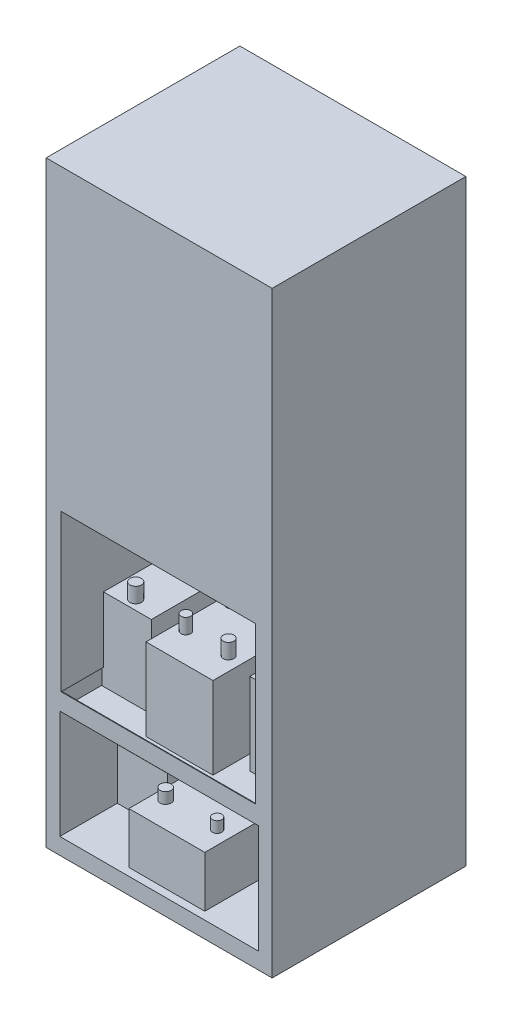
from build123d import *

# Parameters (mm, degrees)
CROQUIS1_W              = 700
CROQUIS1_H              = 600
SALIENTE_EXTRUIR1_DEPTH = 1850
CROQUIS2_W              = 615.213502424
CROQUIS2_H              = 336.389596981
CORTAR_EXTRUIR1_DEPTH   = 1850
CROQUIS3_W              = 601.471689429
CROQUIS3_H              = 484.058253594
CORTAR_EXTRUIR2_DEPTH   = 1850
VACIADO1_START          = 927
VACIADO1_OUTLINE_W      = 696
VACIADO1_OUTLINE_H      = 596
VACIADO1_DEPTH          = 921
VACIADO1_START_2        = 2
VACIADO1_2_OUTLINE_W    = 38.393248788
VACIADO1_2_OUTLINE_H    = 596
VACIADO1_2_DEPTH        = 925
VACIADO1_START_3        = 389.289586049
VACIADO1_3_OUTLINE_W    = 619.213502424
VACIADO1_3_OUTLINE_H    = 596
VACIADO1_3_DEPTH        = 51.652160357
VACIADO1_4_OUTLINE_W    = 619.213502424
VACIADO1_4_OUTLINE_H    = 596
VACIADO1_4_DEPTH        = 46.899989068
VACIADO1_START_4        = 440.941746406
VACIADO1_5_OUTLINE_W    = 9.875527386
VACIADO1_5_OUTLINE_H    = 596
VACIADO1_5_OUTLINE_W_2  = 3.866285609
VACIADO1_5_DEPTH        = 486.058253594
CROQUIS4_W              = 155.811040743
CROQUIS4_H              = 337.39949018
CROQUIS4_W_2            = 207.292949962
CROQUIS4_H_2            = 473.99302583
CROQUIS4_W_3            = 153.187153329
CROQUIS4_H_3            = 334.913299481
SALIENTE_EXTRUIR2_DEPTH = 254
CROQUIS5_R              = 17.695739631
CROQUIS5_R_2            = 14.878547438
CROQUIS5_R_3            = 20.046068399
CROQUIS5_R_4            = 15.612705271
CROQUIS5_R_5            = 20.069748599
CROQUIS5_R_6            = 21.515316786
CROQUIS5_R_7            = 19.11675051
CROQUIS5_R_8            = 16.429789051
SALIENTE_EXTRUIR3_DEPTH = 47
CROQUIS6_W              = 235.100540812
CROQUIS6_H              = 552.359872766
CROQUIS6_W_2            = 155.124272019
CROQUIS6_H_2            = 243.948410626
CROQUIS6_W_3            = 136.509991439
SALIENTE_EXTRUIR4_DEPTH = 158
CROQUIS7_R              = 21.309931324
CROQUIS7_R_2            = 19.709234989
CROQUIS7_R_3            = 17.138465207
CROQUIS7_R_4            = 14.538713976
CROQUIS7_R_5            = 19.196161078
CROQUIS7_R_6            = 15.424618687
CROQUIS7_R_7            = 17.995388468
CROQUIS7_R_8            = 20.519963126
CROQUIS7_R_9            = 17.445012433
CROQUIS7_R_10           = 21.115852911
SALIENTE_EXTRUIR5_DEPTH = 34
SALIENTE_EXTRUIR6_DEPTH = 34
CORTAR_EXTRUIR3_DEPTH   = 0.2
CORTAR_EXTRUIR4_DEPTH   = 0.2
CROQUIS11_R             = 8.638199992
CROQUIS11_R_2           = 9.502019992
CORTAR_EXTRUIR5_DEPTH   = 0.2
MATRIZL1_COUNT          = 36
MATRIZL1_PITCH          = 50
CROQUIS12_R             = 7.900023995
CORTAR_EXTRUIR6_DEPTH   = 0.2
MATRIZL2_COUNT          = 30
MATRIZL2_PITCH          = 20


# Read off the part's stored shape, not the designer's step: Vaciado1
with BuildPart() as part:
    # Croquis1 → Saliente-Extruir1 (new body)
    with BuildSketch(Plane(origin=(0, 0, 0), x_dir=(1, 0, 0), z_dir=(0, 1, 0))):
        Rectangle(CROQUIS1_W, CROQUIS1_H)
    extrude(amount=SALIENTE_EXTRUIR1_DEPTH)

    # Croquis2 → Cortar-Extruir1 (cut)
    with BuildSketch(Plane.XY.offset(300)):
        with Locations((0, 219.094787559)):
            Rectangle(CROQUIS2_W, CROQUIS2_H)
    extrude(amount=-CORTAR_EXTRUIR1_DEPTH, mode=Mode.SUBTRACT)

    # Croquis3 → Cortar-Extruir2 (cut)
    with BuildSketch(Plane.XY.offset(300)):
        with Locations((-3.004620888, 682.970873203)):
            Rectangle(CROQUIS3_W, CROQUIS3_H)
    extrude(amount=-CORTAR_EXTRUIR2_DEPTH, mode=Mode.SUBTRACT)

    # Vaciado1 outline → Vaciado1 (cut)
    with BuildSketch(Plane(origin=(0, 0, 0), x_dir=(1, 0, 0), z_dir=(0, 1, 0)).offset(VACIADO1_START)):
        Rectangle(VACIADO1_OUTLINE_W, VACIADO1_OUTLINE_H)
    extrude(amount=VACIADO1_DEPTH, mode=Mode.SUBTRACT)

    # Vaciado1 2 outline → Vaciado1 2 (cut)
    with BuildSketch(Plane(origin=(0, 0, 0), x_dir=(1, 0, 0), z_dir=(0, 1, 0)).offset(VACIADO1_START_2)):
        with Locations((328.803375606, 0)):
            Rectangle(VACIADO1_2_OUTLINE_W, VACIADO1_2_OUTLINE_H)
        with Locations((-328.803375606, 0)):
            Rectangle(VACIADO1_2_OUTLINE_W, VACIADO1_2_OUTLINE_H)
    extrude(amount=VACIADO1_2_DEPTH, mode=Mode.SUBTRACT)

    # Vaciado1 3 outline → Vaciado1 3 (cut)
    with BuildSketch(Plane(origin=(0, 0, 0), x_dir=(1, 0, 0), z_dir=(0, 1, 0)).offset(VACIADO1_START_3)):
        Rectangle(VACIADO1_3_OUTLINE_W, VACIADO1_3_OUTLINE_H)
    extrude(amount=VACIADO1_3_DEPTH, mode=Mode.SUBTRACT)

    # Vaciado1 4 outline → Vaciado1 4 (cut)
    with BuildSketch(Plane(origin=(0, 0, 0), x_dir=(1, 0, 0), z_dir=(0, 1, 0)).offset(VACIADO1_START_2)):
        Rectangle(VACIADO1_4_OUTLINE_W, VACIADO1_4_OUTLINE_H)
    extrude(amount=VACIADO1_4_DEPTH, mode=Mode.SUBTRACT)

    # Vaciado1 5 outline → Vaciado1 5 (cut)
    with BuildSketch(Plane(origin=(0, 0, 0), x_dir=(1, 0, 0), z_dir=(0, 1, 0)).offset(VACIADO1_START_4)):
        with Locations((304.668987519, 0)):
            Rectangle(VACIADO1_5_OUTLINE_W, VACIADO1_5_OUTLINE_H)
        with Locations((-307.673608408, 0)):
            Rectangle(VACIADO1_5_OUTLINE_W_2, VACIADO1_5_OUTLINE_H)
    extrude(amount=VACIADO1_5_DEPTH, mode=Mode.SUBTRACT)

    # Croquis4 → Saliente-Extruir2 (add)
    with BuildSketch(Plane(origin=(0, 389.289586049, 0), x_dir=(1, 0, 0), z_dir=(0, 1, 0))):
        with Locations((227.516652399, 0)):
            Rectangle(CROQUIS4_W, CROQUIS4_H)
        Rectangle(CROQUIS4_W_2, CROQUIS4_H_2)
        with Locations((-232.063289137, -1.24309535)):
            Rectangle(CROQUIS4_W_3, CROQUIS4_H_3)
    extrude(amount=SALIENTE_EXTRUIR2_DEPTH)

    # Croquis5 → Saliente-Extruir3 (add)
    with BuildSketch(Plane(origin=(0, 643.289586049, 0), x_dir=(1, 0, 0), z_dir=(0, 1, 0))):
        with Locations(Location((230.044615203, -120.710223911, 0), (0, 0, 270))):
            Circle(CROQUIS5_R)
        with Locations(Location((230.044615203, 47.399302583, 0), (0, 0, 270))):
            Circle(CROQUIS5_R)
        with Locations(Location((-71.150795338, -146.026983278, 0), (0, 0, 270))):
            Circle(CROQUIS5_R_2)
        with Locations(Location((-71.150795338, 0, 0), (0, 0, 270))):
            Circle(CROQUIS5_R_3)
        with Locations(Location((-234.150032562, -138.405963542, 0), (0, 0, 270))):
            Circle(CROQUIS5_R)
        with Locations(Location((-234.150032562, 47.399302583, 0), (0, 0, 270))):
            Circle(CROQUIS5_R_4)
        with Locations(Location((-71.150795338, 166.603557417, 0), (0, 0, 270))):
            Circle(CROQUIS5_R_5)
        with Locations(Location((61.00370715, 0, 0), (0, 0, 270))):
            Circle(CROQUIS5_R_6)
        with Locations(Location((61.00370715, 166.603557417, 0), (0, 0, 270))):
            Circle(CROQUIS5_R_7)
        with Locations(Location((61.00370715, -146.026983278, 0), (0, 0, 270))):
            Circle(CROQUIS5_R_8)
    extrude(amount=SALIENTE_EXTRUIR3_DEPTH)

    # Croquis6 → Saliente-Extruir4 (add)
    with BuildSketch(Plane(origin=(0, 50.899989068, 0), x_dir=(1, 0, 0), z_dir=(0, 1, 0))):
        Rectangle(CROQUIS6_W, CROQUIS6_H)
        with Locations((-230.044615203, 0)):
            Rectangle(CROQUIS6_W_2, CROQUIS6_H_2)
        with Locations((221.196745388, 0)):
            Rectangle(CROQUIS6_W_3, CROQUIS6_H_2)
    extrude(amount=SALIENTE_EXTRUIR4_DEPTH)

    # Croquis7 → Saliente-Extruir5 (add)
    with BuildSketch(Plane(origin=(0, 208.899989068, 0), x_dir=(1, 0, 0), z_dir=(0, 1, 0))):
        with Locations(Location((220.490094395, -83.441653157, 0), (0, 0, 270))):
            Circle(CROQUIS7_R)
        with Locations(Location((220.490094395, 65.548722345, 0), (0, 0, 270))):
            Circle(CROQUIS7_R_2)
        with Locations(Location((-83.717663037, -196.012159091, 0), (0, 0, 270))):
            Circle(CROQUIS7_R_3)
        with Locations(Location((75.670063393, -196.012159091, 0), (0, 0, 270))):
            Circle(CROQUIS7_R_4)
        with Locations(Location((-83.717663037, 0, 0), (0, 0, 270))):
            Circle(CROQUIS7_R_5)
        with Locations(Location((75.670063393, 5.952572144, 0), (0, 0, 270))):
            Circle(CROQUIS7_R_6)
        with Locations(Location((-83.717663037, 184.741022746, 0), (0, 0, 270))):
            Circle(CROQUIS7_R_7)
        with Locations(Location((75.670063393, 184.741022746, 0), (0, 0, 270))):
            Circle(CROQUIS7_R_8)
        with Locations(Location((-230.044615203, -62.131721832, 0), (0, 0, 270))):
            Circle(CROQUIS7_R_9)
        with Locations(Location((-230.044615203, 45.839487356, 0), (0, 0, 270))):
            Circle(CROQUIS7_R_10)
    extrude(amount=SALIENTE_EXTRUIR5_DEPTH)

    # Croquis8 → Saliente-Extruir6 (add)
    with BuildSketch(Plane(origin=(0, 0, -300), x_dir=(-1, 0, 0), z_dir=(0, 0, -1))):
        with BuildLine():
            Line((-250.090251242, 1244.393397196), (250.090251242, 1244.393397196))
            ThreePointArc((250.090251242, 1244.393397196), (285.445590301, 1259.038058137), (300.090251242, 1294.393397196))
            Line((300.090251242, 1294.393397196), (300.090251242, 1716.628379876))
            ThreePointArc((300.090251242, 1716.628379876), (285.445590301, 1751.983718936), (250.090251242, 1766.628379876))
            Line((250.090251242, 1766.628379876), (-250.090251242, 1766.628379876))
            ThreePointArc((-250.090251242, 1766.628379876), (-285.445590301, 1751.983718936), (-300.090251242, 1716.628379876))
            Line((-300.090251242, 1716.628379876), (-300.090251242, 1294.393397196))
            ThreePointArc((-300.090251242, 1294.393397196), (-285.445590301, 1259.038058137), (-250.090251242, 1244.393397196))
        make_face()
    extrude(amount=SALIENTE_EXTRUIR6_DEPTH)

    # Croquis9 → Cortar-Extruir3 (cut)
    with BuildSketch(Plane(origin=(0, 0, -334), x_dir=(-1, 0, 0), z_dir=(0, 0, -1))):
        with BuildLine():
            Line((-270.600639063, 1733.863514853), (-189.333354346, 1733.863514853))
            ThreePointArc((-189.333354346, 1733.863514853), (-183.676500096, 1731.520369103), (-181.333354346, 1725.863514853))
            Line((-181.333354346, 1725.863514853), (-181.333354346, 1662.281190994))
            ThreePointArc((-181.333354346, 1662.281190994), (-183.676500096, 1656.624336745), (-189.333354346, 1654.281190994))
            Line((-189.333354346, 1654.281190994), (-270.600639063, 1654.281190994))
            ThreePointArc((-270.600639063, 1654.281190994), (-276.257493312, 1656.624336745), (-278.600639063, 1662.281190994))
            Line((-278.600639063, 1662.281190994), (-278.600639063, 1725.863514853))
            ThreePointArc((-278.600639063, 1725.863514853), (-276.257493312, 1731.520369103), (-270.600639063, 1733.863514853))
        make_face()
        with BuildLine():
            Line((-51.317584016, 1706.482239835), (264.60670626, 1706.482239835))
            ThreePointArc((264.60670626, 1706.482239835), (273.799094416, 1702.674627991), (277.60670626, 1693.482239835))
            Line((277.60670626, 1693.482239835), (277.60670626, 1530.563130838))
            ThreePointArc((277.60670626, 1530.563130838), (273.799094416, 1521.370742683), (264.60670626, 1517.563130838))
            Line((264.60670626, 1517.563130838), (-51.317584016, 1517.563130838))
            ThreePointArc((-51.317584016, 1517.563130838), (-60.509972172, 1521.370742683), (-64.317584016, 1530.563130838))
            Line((-64.317584016, 1530.563130838), (-64.317584016, 1693.482239835))
            ThreePointArc((-64.317584016, 1693.482239835), (-60.509972172, 1702.674627991), (-51.317584016, 1706.482239835))
        make_face()
    extrude(amount=-CORTAR_EXTRUIR3_DEPTH, mode=Mode.SUBTRACT)

    # Croquis10 → Cortar-Extruir4 (cut)
    # profile 1 of 5: a face of its own
    with BuildSketch(Plane(origin=(0, 0, -334), x_dir=(-1, 0, 0), z_dir=(0, 0, -1))):
        with BuildLine():
            Line((-265.210374691, 1349.32203096), (-259.618719709, 1352.674373875))
            add(Edge.make_bspline(
                [(-259.618719709, 1352.674373875), (-259.098657785, 1351.803811838), (-258.102239208, 1350.135848571), (-256.440063224, 1347.882013581), (-254.717759694, 1345.966389487), (-252.922574373, 1344.400120267), (-251.065464937, 1343.166993985), (-249.134307969, 1342.293826808), (-247.135611248, 1341.749239178), (-245.775391706, 1341.683091709), (-245.096317199, 1341.65006832)],
                knots=[0, 0, 0, 0, 1.272034388, 2.437168799, 3.508375237, 4.49857839, 5.41946034, 6.295179144, 7.148887113, 8, 8, 8, 8], degree=3))
            add(Edge.make_bspline(
                [(-245.096317199, 1341.65006832), (-244.516372067, 1341.666220613), (-243.366629481, 1341.698242571), (-241.674009711, 1342.005930348), (-240.030157198, 1342.478629808), (-238.468952288, 1343.15560277), (-237.011936954, 1343.974648557), (-235.734250897, 1344.963928995), (-234.629688936, 1346.071516513), (-233.726153586, 1347.30717085), (-233.032944586, 1348.636081247), (-232.500148055, 1350.000120804), (-232.204474788, 1351.420717258), (-232.159934953, 1352.377194755), (-232.137458024, 1352.859879017)],
                knots=[0, 0, 0, 0, 1.095163259, 2.171163733, 3.241058638, 4.321873601, 5.38011039, 6.391990106, 7.366004449, 8.327778327, 9.272591725, 10.192022065, 11.087607919, 12, 12, 12, 12], degree=3))
            add(Edge.make_bspline(
                [(-232.137458024, 1352.859879017), (-232.165320741, 1353.410606385), (-232.221961573, 1354.530154647), (-232.70069639, 1356.181904041), (-233.453799716, 1357.816510647), (-234.148569917, 1358.827620874), (-234.509273763, 1359.352558971)],
                knots=[0, 0, 0, 0, 0.938893495, 1.908633276, 2.914225137, 4, 4, 4, 4], degree=3))
            add(Edge.make_bspline(
                [(-234.509273763, 1359.352558971), (-234.805429715, 1359.731420072), (-235.427172092, 1360.526791563), (-236.49604175, 1361.710711936), (-237.750282303, 1362.931923127), (-239.14697151, 1364.23705709), (-240.736986731, 1365.565412772), (-242.470527554, 1366.980334096), (-244.39185346, 1368.42801271), (-245.739329066, 1369.398893041), (-246.434604291, 1369.899851306)],
                knots=[0, 0, 0, 0, 0.722233717, 1.516239348, 2.393582979, 3.351407094, 4.387010283, 5.505090956, 6.712668013, 8, 8, 8, 8], degree=3))
            add(Edge.make_bspline(
                [(-246.434604291, 1369.899851306), (-247.130533981, 1370.395540387), (-248.461098553, 1371.343260165), (-250.321848547, 1372.749790532), (-251.985784083, 1374.035738662), (-253.445509544, 1375.213210319), (-254.700382878, 1376.2823652), (-255.76029258, 1377.232936372), (-256.598238525, 1378.090631644), (-257.064199647, 1378.647037954), (-257.273404705, 1378.896850671)],
                knots=[0, 0, 0, 0, 1.452282411, 2.77665338, 3.964542531, 5.026858415, 5.96415736, 6.766646006, 7.446254459, 8, 8, 8, 8], degree=3))
            add(Edge.make_bspline(
                [(-257.273404705, 1378.896850671), (-257.565817391, 1379.286185743), (-258.14088618, 1380.051865412), (-258.899975866, 1381.248629837), (-259.545165401, 1382.473712383), (-260.050941619, 1383.730405062), (-260.476849326, 1385.001065176), (-260.763316171, 1386.302271754), (-260.942692274, 1387.628186121), (-260.961061662, 1388.520465076), (-260.970257169, 1388.967129785)],
                knots=[0, 0, 0, 0, 1.068054152, 2.10047183, 3.106115577, 4.101338837, 5.06977816, 6.043150881, 7.020423561, 8, 8, 8, 8], degree=3))
            add(Edge.make_bspline(
                [(-260.970257169, 1388.967129785), (-260.945590273, 1389.666948441), (-260.896783718, 1391.051627622), (-260.484023943, 1393.074382899), (-259.832527292, 1395.005584534), (-258.919811405, 1396.826113163), (-257.743221551, 1398.48856548), (-256.381638404, 1400.012064416), (-254.759903471, 1401.292809943), (-252.980530978, 1402.411847356), (-251.032888232, 1403.287730168), (-248.991988718, 1403.948451073), (-246.854588696, 1404.322822461), (-245.406880646, 1404.376547334), (-244.672305447, 1404.403807636)],
                knots=[0, 0, 0, 0, 1.005424448, 1.989358655, 2.955360095, 3.929531133, 4.905563448, 5.876582895, 6.856512386, 7.866279853, 8.892233794, 9.918561126, 10.94386622, 12, 12, 12, 12], degree=3))
            add(Edge.make_bspline(
                [(-244.672305447, 1404.403807636), (-243.892841051, 1404.376923104), (-242.342735148, 1404.323458351), (-240.062608603, 1403.858594292), (-237.86730935, 1403.089400048), (-236.101342887, 1402.216489399), (-234.719220758, 1401.344660561), (-233.665182506, 1400.550535905), (-232.597069969, 1399.636303942), (-231.506267445, 1398.5995295), (-230.411257958, 1397.430699531), (-229.295784977, 1396.137818952), (-228.157240016, 1394.728788804), (-227.424800397, 1393.722909102), (-227.049316998, 1393.207247306)],
                knots=[0, 0, 0, 0, 1.286793592, 2.559021753, 3.825965368, 5.121522368, 5.803751409, 6.523245864, 7.299691795, 8.125521123, 9.008227632, 9.944561021, 10.946284179, 12, 12, 12, 12], degree=3))
            Line((-227.049316998, 1393.207247306), (-232.415715736, 1389.139384559))
            add(Edge.make_bspline(
                [(-232.415715736, 1389.139384559), (-232.739753448, 1389.556834512), (-233.363774319, 1390.360745518), (-234.311161942, 1391.486572464), (-235.20410514, 1392.514979146), (-236.083852278, 1393.408233798), (-236.903940254, 1394.215253282), (-237.699902213, 1394.906189163), (-238.460283553, 1395.487811279), (-239.418772787, 1396.108515462), (-240.622961809, 1396.723794622), (-242.134574325, 1397.244439401), (-243.714255415, 1397.557310363), (-244.790157677, 1397.598677732), (-245.334823809, 1397.619619602)],
                knots=[0, 0, 0, 0, 1.181633172, 2.275549214, 3.290209073, 4.226197932, 5.078386478, 5.862611352, 6.581680152, 7.217281963, 8.414376989, 9.595101626, 10.782541182, 12, 12, 12, 12], degree=3))
            add(Edge.make_bspline(
                [(-245.334823809, 1397.619619602), (-246.018139039, 1397.596719915), (-247.33584809, 1397.552560027), (-249.206645707, 1397.070262686), (-250.890414827, 1396.310873361), (-252.337167172, 1395.246587317), (-253.541720161, 1393.985639985), (-254.413058444, 1392.534611028), (-254.937503518, 1390.93232455), (-255.001500172, 1389.814617652), (-255.034092639, 1389.245387497)],
                knots=[0, 0, 0, 0, 1.14458467, 2.207223713, 3.21896685, 4.227309161, 5.202851033, 6.127160689, 7.046193047, 8, 8, 8, 8], degree=3))
            add(Edge.make_bspline(
                [(-255.034092639, 1389.245387497), (-255.026663014, 1388.891006876), (-255.011791614, 1388.181666151), (-254.804381003, 1387.13370029), (-254.537920471, 1386.088381822), (-254.115671329, 1385.05041039), (-253.532731811, 1384.001633069), (-252.767232207, 1382.923990112), (-251.80314134, 1381.807983118), (-251.064632326, 1381.082129476), (-250.674721813, 1380.698900618)],
                knots=[0, 0, 0, 0, 0.858281714, 1.717966888, 2.583508476, 3.4729293, 4.427298488, 5.488583878, 6.674047936, 8, 8, 8, 8], degree=3))
            add(Edge.make_bspline(
                [(-250.674721813, 1380.698900618), (-250.529930995, 1380.569688969), (-250.185941155, 1380.262711669), (-249.557065772, 1379.760149222), (-248.726599199, 1379.140215877), (-247.716227242, 1378.373163914), (-246.507320257, 1377.483380329), (-245.099745312, 1376.482242123), (-243.509192534, 1375.337249073), (-242.380519421, 1374.536741982), (-241.783725385, 1374.113468093)],
                knots=[0, 0, 0, 0, 0.420754252, 0.999615792, 1.744751191, 2.668019286, 3.750313428, 4.999500688, 6.413464383, 8, 8, 8, 8], degree=3))
            add(Edge.make_bspline(
                [(-241.783725385, 1374.113468093), (-241.065836845, 1373.591079303), (-239.675745184, 1372.579545815), (-237.697841516, 1371.059785195), (-235.904461512, 1369.573435998), (-234.289308707, 1368.129990149), (-232.836426657, 1366.740396725), (-231.561934019, 1365.387937811), (-230.452844525, 1364.082302732), (-229.258832509, 1362.408386495), (-228.038766575, 1360.352553504), (-226.990988086, 1357.83375346), (-226.330316936, 1355.305162284), (-226.243920737, 1353.60565213), (-226.201293494, 1352.767126446)],
                knots=[0, 0, 0, 0, 1.163667725, 2.253281268, 3.268753668, 4.215851969, 5.092017293, 5.902905408, 6.650798638, 7.335211899, 8.59617414, 9.77448103, 10.901945474, 12, 12, 12, 12], degree=3))
            add(Edge.make_bspline(
                [(-226.201293494, 1352.767126446), (-226.213712622, 1352.174112701), (-226.238309708, 1350.999601137), (-226.521053168, 1349.274988821), (-226.935308744, 1347.599970897), (-227.559673136, 1345.995251956), (-228.321732823, 1344.431474447), (-229.288713996, 1342.949658472), (-230.409558633, 1341.517007785), (-231.695315797, 1340.17172454), (-233.102254725, 1338.936759229), (-234.589282883, 1337.838189169), (-236.158834172, 1336.922195557), (-237.802394026, 1336.174731726), (-239.520339973, 1335.590125071), (-241.312094221, 1335.166548526), (-243.180610281, 1334.906581966), (-244.450619382, 1334.879598974), (-245.096317199, 1334.865880285)],
                knots=[0, 0, 0, 0, 0.983748083, 1.948392443, 2.894712957, 3.844097841, 4.80183111, 5.778335162, 6.776009319, 7.81870978, 8.863265674, 9.881300176, 10.883814829, 11.87499822, 12.874611388, 13.892143829, 14.928324115, 16, 16, 16, 16], degree=3))
            add(Edge.make_bspline(
                [(-245.096317199, 1334.865880285), (-245.59591371, 1334.875541009), (-246.588814831, 1334.89474079), (-248.057431527, 1335.064476297), (-249.49637912, 1335.304625428), (-250.887601414, 1335.685891334), (-252.249022736, 1336.148477061), (-253.57472196, 1336.718055668), (-254.865341579, 1337.400627778), (-256.12811435, 1338.181054583), (-257.359828661, 1339.089288744), (-258.548931701, 1340.147121191), (-259.73443863, 1341.325377015), (-260.881358173, 1342.65605284), (-262.012889323, 1344.117650537), (-263.106722361, 1345.723844926), (-264.18549887, 1347.465887177), (-264.862368575, 1348.691760077), (-265.210374691, 1349.32203096)],
                knots=[0, 0, 0, 0, 0.915332311, 1.819136955, 2.706846663, 3.586547465, 4.459518054, 5.340707479, 6.227863349, 7.133153174, 8.059268498, 9.028702269, 10.047606654, 11.120612155, 12.245963614, 13.433783089, 14.680604001, 16, 16, 16, 16], degree=3))
        make_face()
    # profile 2 of 5: a face of its own
    with BuildSketch(Plane(origin=(0, 0, -334), x_dir=(-1, 0, 0), z_dir=(0, 0, -1))):
        Polygon((-212.632917426, 1402.707760627), (-175.319883238, 1402.707760627), (-175.319883238, 1395.923572593), (-206.696752896, 1395.923572593), (-206.696752896, 1375.571008491), (-175.319883238, 1375.571008491), (-175.319883238, 1368.786820456), (-206.696752896, 1368.786820456), (-206.696752896, 1343.346115328), (-175.319883238, 1343.346115328), (-175.319883238, 1336.561927294), (-212.632917426, 1336.561927294), align=None)
    # profile 3 of 5: a face of its own
    with BuildSketch(Plane(origin=(0, 0, -334), x_dir=(-1, 0, 0), z_dir=(0, 0, -1))):
        with BuildLine():
            Line((-163.447554178, 1336.561927294), (-163.447554178, 1402.707760627))
            Line((-163.447554178, 1402.707760627), (-150.091183986, 1402.707760627))
            add(Edge.make_bspline(
                [(-150.091183986, 1402.707760627), (-148.929493286, 1402.699396581), (-146.6851129, 1402.683237288), (-143.441841943, 1402.580779449), (-140.441017861, 1402.399531062), (-137.692509959, 1402.135523648), (-135.188772768, 1401.811351733), (-132.93681693, 1401.405019687), (-130.924998158, 1400.925213491), (-129.687703671, 1400.516140249), (-129.102602255, 1400.322694522)],
                knots=[0, 0, 0, 0, 1.314313732, 2.53924729, 3.670748893, 4.714932338, 5.66265055, 6.526160246, 7.303039223, 8, 8, 8, 8], degree=3))
            add(Edge.make_bspline(
                [(-129.102602255, 1400.322694522), (-128.33729989, 1400.031072555), (-126.824049679, 1399.45444164), (-124.669450785, 1398.366696064), (-122.641129193, 1397.134246076), (-120.728207854, 1395.755467123), (-118.974382712, 1394.191319466), (-117.311138235, 1392.508246568), (-115.806514735, 1390.645044305), (-114.428634735, 1388.640353312), (-113.186309028, 1386.517789229), (-112.106446968, 1384.28139655), (-111.209622986, 1381.942532648), (-110.4651379, 1379.507701726), (-109.878396813, 1376.971549943), (-109.47808352, 1374.331124201), (-109.214048444, 1371.596859758), (-109.187513546, 1369.741479268), (-109.174049904, 1368.800070824)],
                knots=[0, 0, 0, 0, 0.984719456, 1.947108742, 2.898477687, 3.838006223, 4.779231079, 5.722358779, 6.681677486, 7.655904652, 8.64651281, 9.637519902, 10.640069247, 11.656948941, 12.698408672, 13.768548281, 14.867775369, 16, 16, 16, 16], degree=3))
            add(Edge.make_bspline(
                [(-109.174049904, 1368.800070824), (-109.185936641, 1367.982484918), (-109.209360697, 1366.371346496), (-109.419691518, 1363.996883141), (-109.725404709, 1361.692861778), (-110.198710234, 1359.470254054), (-110.773281544, 1357.309586841), (-111.509657618, 1355.233888175), (-112.353215358, 1353.224116779), (-113.336896099, 1351.307447219), (-114.41680025, 1349.491585867), (-115.575708194, 1347.779816214), (-116.812383836, 1346.196564254), (-118.138619756, 1344.737035425), (-119.537277492, 1343.40343), (-121.017514097, 1342.184607686), (-122.583149134, 1341.104416843), (-124.227170233, 1340.120410482), (-125.997537556, 1339.262019835), (-127.927783837, 1338.5357384), (-130.026140921, 1337.933875282), (-132.287458261, 1337.431716983), (-134.715643034, 1337.033381055), (-137.31307587, 1336.766409055), (-140.075766018, 1336.58587), (-141.972814632, 1336.570063161), (-142.949236036, 1336.561927294)],
                knots=[0, 0, 0, 0, 1.105936401, 2.179363191, 3.223086493, 4.248585256, 5.251745608, 6.245858792, 7.225916811, 8.198733463, 9.158002045, 10.082870192, 10.993790845, 11.873723703, 12.748670949, 13.606408763, 14.465103618, 15.319838547, 16.196477973, 17.123216899, 18.106603292, 19.147568657, 20.255746949, 21.433717677, 22.679120308, 24, 24, 24, 24], degree=3))
            Line((-142.949236036, 1336.561927294), (-163.447554178, 1336.561927294))
        make_face()
        with BuildLine():
            Line((-157.511389648, 1343.346115328), (-149.918929211, 1343.346115328))
            add(Edge.make_bspline(
                [(-149.918929211, 1343.346115328), (-148.827931729, 1343.350804054), (-146.72954402, 1343.359822192), (-143.712197941, 1343.438955346), (-140.955251013, 1343.56825982), (-138.458311773, 1343.749217392), (-136.222790034, 1343.988639137), (-134.244013809, 1344.255582983), (-132.528469492, 1344.588153853), (-131.490368526, 1344.889607997), (-131.010655139, 1345.028911969)],
                knots=[0, 0, 0, 0, 1.375205317, 2.645023457, 3.804390687, 4.853969522, 5.800190428, 6.637939096, 7.370582563, 8, 8, 8, 8], degree=3))
            add(Edge.make_bspline(
                [(-131.010655139, 1345.028911969), (-130.40686913, 1345.241553026), (-129.213718527, 1345.66175621), (-127.496174209, 1346.428247724), (-125.894367722, 1347.336185649), (-124.380383613, 1348.345425053), (-122.97569831, 1349.491562294), (-121.663665159, 1350.749674731), (-120.446925758, 1352.126165272), (-119.338051188, 1353.619325468), (-118.345706751, 1355.219861785), (-117.486354648, 1356.912039147), (-116.733208143, 1358.677316662), (-116.142079979, 1360.542802249), (-115.678764624, 1362.491818681), (-115.350592693, 1364.524503068), (-115.146207276, 1366.640475806), (-115.122367411, 1368.079660297), (-115.110214434, 1368.813321191)],
                knots=[0, 0, 0, 0, 0.998632004, 1.973411704, 2.929992603, 3.868527914, 4.809262121, 5.754881198, 6.702106254, 7.672490631, 8.653608572, 9.636854334, 10.631411391, 11.644891563, 12.686317036, 13.754757253, 14.855430412, 16, 16, 16, 16], degree=3))
            add(Edge.make_bspline(
                [(-115.110214434, 1368.813321191), (-115.119914954, 1369.586915238), (-115.138971712, 1371.106647592), (-115.378501091, 1373.336531267), (-115.72853644, 1375.481180466), (-116.234716221, 1377.540738623), (-116.879749199, 1379.51922385), (-117.68473722, 1381.40569376), (-118.604478388, 1383.22007149), (-119.698782522, 1384.92047989), (-120.897261742, 1386.528638352), (-122.227319878, 1388.001893453), (-123.667825666, 1389.343601211), (-125.203067612, 1390.574656673), (-126.876313387, 1391.645532691), (-128.648146531, 1392.603450622), (-130.544560257, 1393.416399759), (-131.863937098, 1393.848783028), (-132.534447374, 1394.068521178)],
                knots=[0, 0, 0, 0, 1.122418816, 2.205001699, 3.251619955, 4.274784885, 5.280384055, 6.268708349, 7.249350384, 8.229342522, 9.199999885, 10.157847722, 11.105861043, 12.055065948, 13.010012805, 13.98527497, 14.976112212, 16, 16, 16, 16], degree=3))
            add(Edge.make_bspline(
                [(-132.534447374, 1394.068521178), (-133.089149098, 1394.221912002), (-134.268597159, 1394.54806298), (-136.193241791, 1394.90384011), (-138.359331669, 1395.217645374), (-140.776483758, 1395.483325582), (-143.441942732, 1395.673963947), (-146.357758562, 1395.817052779), (-149.525191565, 1395.913562054), (-151.720903142, 1395.920152205), (-152.860510742, 1395.923572593)],
                knots=[0, 0, 0, 0, 0.674548936, 1.434276114, 2.292660221, 3.240891867, 4.284742987, 5.42552168, 6.663806718, 8, 8, 8, 8], degree=3))
            Line((-152.860510742, 1395.923572593), (-157.511389648, 1395.923572593))
            Line((-157.511389648, 1395.923572593), (-157.511389648, 1343.346115328))
        make_face(mode=Mode.SUBTRACT)
    # profile 4 of 5: a face of its own
    with BuildSketch(Plane(origin=(0, 0, -334), x_dir=(-1, 0, 0), z_dir=(0, 0, -1))):
        with BuildLine():
            Line((-95.605673836, 1402.707760627), (-82.633564294, 1402.707760627))
            add(Edge.make_bspline(
                [(-82.633564294, 1402.707760627), (-81.741334371, 1402.70677985), (-80.031782215, 1402.704900638), (-77.580322085, 1402.64792553), (-75.353858407, 1402.571825844), (-73.357191982, 1402.466334707), (-71.584179414, 1402.341667005), (-70.042843545, 1402.166814475), (-68.721069191, 1401.984246389), (-67.929087185, 1401.798633498), (-67.567896726, 1401.713983083)],
                knots=[0, 0, 0, 0, 1.415646017, 2.712440637, 3.8905458, 4.950247383, 5.884950622, 6.709939814, 7.411656543, 8, 8, 8, 8], degree=3))
            add(Edge.make_bspline(
                [(-67.567896726, 1401.713983083), (-67.110667739, 1401.588836115), (-66.206983795, 1401.341491109), (-64.904836105, 1400.846082943), (-63.665946466, 1400.258667023), (-62.486064335, 1399.589196731), (-61.379688658, 1398.808948718), (-60.330312586, 1397.949551478), (-59.347196887, 1396.991163203), (-58.435869987, 1395.944533149), (-57.598940032, 1394.827231563), (-56.878334421, 1393.622579302), (-56.274947839, 1392.350853776), (-55.757436607, 1391.012939559), (-55.38497028, 1389.5976016), (-55.10438155, 1388.114674149), (-54.926286207, 1386.564316165), (-54.909228864, 1385.504851406), (-54.900545631, 1384.965518874)],
                knots=[0, 0, 0, 0, 0.999701418, 1.975846123, 2.934577507, 3.890451536, 4.834027766, 5.787354733, 6.749476667, 7.726910423, 8.712836071, 9.690891519, 10.682875813, 11.679750201, 12.712814741, 13.765529915, 14.8625177, 16, 16, 16, 16], degree=3))
            add(Edge.make_bspline(
                [(-54.900545631, 1384.965518874), (-54.908510057, 1384.421653152), (-54.924092993, 1383.357543134), (-55.111121005, 1381.8007955), (-55.363045757, 1380.313111639), (-55.750415645, 1378.897790179), (-56.257766907, 1377.563236184), (-56.852929215, 1376.289055162), (-57.570772721, 1375.096924458), (-58.395608044, 1373.982516135), (-59.313175379, 1372.944784161), (-60.319592514, 1371.991248611), (-61.410796405, 1371.127491024), (-62.583319143, 1370.351575005), (-63.848591584, 1369.681493533), (-65.187423951, 1369.081318276), (-66.611453339, 1368.577266981), (-67.596884778, 1368.312115523), (-68.097911416, 1368.177303563)],
                knots=[0, 0, 0, 0, 1.121902311, 2.195077645, 3.232258892, 4.234102512, 5.217864754, 6.176164875, 7.132989551, 8.084763148, 9.034132444, 9.988522005, 10.94243251, 11.903244335, 12.886203696, 13.894208494, 14.929344452, 16, 16, 16, 16], degree=3))
            add(Edge.make_bspline(
                [(-68.097911416, 1368.177303563), (-68.512311925, 1368.089178771), (-69.420494733, 1367.896048168), (-70.916197965, 1367.680441915), (-72.657636062, 1367.496412854), (-74.642432126, 1367.358430046), (-76.868804585, 1367.240305523), (-79.337957811, 1367.146414463), (-82.054738734, 1367.094823475), (-83.949745877, 1367.092162659), (-84.939128196, 1367.090773448)],
                knots=[0, 0, 0, 0, 0.601384939, 1.31797006, 2.144135048, 3.087295005, 4.142315834, 5.309527816, 6.595305764, 8, 8, 8, 8], degree=3))
            Line((-84.939128196, 1367.090773448), (-89.669509306, 1367.090773448))
            Line((-89.669509306, 1367.090773448), (-89.669509306, 1336.561927294))
            Line((-89.669509306, 1336.561927294), (-95.605673836, 1336.561927294))
            Line((-95.605673836, 1336.561927294), (-95.605673836, 1402.707760627))
        make_face()
        with BuildLine():
            Line((-89.669509306, 1395.923572593), (-89.669509306, 1373.874961482))
            Line((-89.669509306, 1373.874961482), (-78.088688326, 1373.729207442))
            add(Edge.make_bspline(
                [(-78.088688326, 1373.729207442), (-77.523237347, 1373.728915199), (-76.43164589, 1373.728351029), (-74.8548006, 1373.803667008), (-73.391857224, 1373.890611599), (-72.047309445, 1374.017912533), (-70.820551159, 1374.197852965), (-69.709536849, 1374.379503369), (-68.722881354, 1374.642298168), (-67.568179177, 1374.996141885), (-66.281484962, 1375.599630306), (-64.88169647, 1376.47558805), (-63.695407115, 1377.592143101), (-62.668855971, 1378.847550032), (-61.854206194, 1380.244155603), (-61.257835506, 1381.738464378), (-60.907429705, 1383.315151415), (-60.860443604, 1384.394049277), (-60.836710161, 1384.939018139)],
                knots=[0, 0, 0, 0, 1.160613943, 2.240541288, 3.23993089, 4.169200891, 5.011653406, 5.7853311, 6.478053781, 7.106038997, 8.262395093, 9.384106736, 10.481365981, 11.59014053, 12.70357646, 13.786202915, 14.881775077, 16, 16, 16, 16], degree=3))
            add(Edge.make_bspline(
                [(-60.836710161, 1384.939018139), (-60.860572676, 1385.470802545), (-60.908008404, 1386.527924128), (-61.260582008, 1388.077225109), (-61.85304672, 1389.555786785), (-62.674324622, 1390.934891225), (-63.671069191, 1392.185780824), (-64.829553801, 1393.272408076), (-66.147051448, 1394.145943232), (-67.372605814, 1394.70975674), (-68.461199657, 1395.05400376), (-69.406744137, 1395.294866073), (-70.474350634, 1395.487172917), (-71.664366705, 1395.642889711), (-72.967568774, 1395.776191731), (-74.395152999, 1395.866641003), (-75.941711436, 1395.919585191), (-77.015363594, 1395.92221128), (-77.571924003, 1395.923572593)],
                knots=[0, 0, 0, 0, 1.120700087, 2.227813068, 3.331159281, 4.466773991, 5.599788987, 6.693661531, 7.80175334, 8.91857717, 9.525282508, 10.207424825, 10.974604443, 11.810962634, 12.737642355, 13.736264703, 14.826523623, 16, 16, 16, 16], degree=3))
            Line((-77.571924003, 1395.923572593), (-89.669509306, 1395.923572593))
        make_face(mode=Mode.SUBTRACT)
    # profile 5 of 5: a face of its own
    with BuildSketch(Plane(origin=(0, 0, -334), x_dir=(-1, 0, 0), z_dir=(0, 0, -1))):
        with BuildLine():
            Line((19.725522745, 1390.570424222), (14.531378781, 1386.595314046))
            add(Edge.make_bspline(
                [(14.531378781, 1386.595314046), (14.160850832, 1387.036903059), (13.424790453, 1387.914127508), (12.24060612, 1389.145943304), (11.006482809, 1390.300004048), (9.722892274, 1391.381807428), (8.366730343, 1392.35352309), (6.970849178, 1393.26578947), (5.511898026, 1394.083498208), (3.494417327, 1395.07498619), (0.855239241, 1396.109623345), (-2.467073937, 1396.97713977), (-5.935215233, 1397.529385204), (-8.301300821, 1397.58919694), (-9.504787418, 1397.619619602)],
                knots=[0, 0, 0, 0, 0.757959112, 1.505699292, 2.245454638, 2.979532153, 3.711538275, 4.438200793, 5.171680507, 5.909471876, 7.393775596, 8.890124382, 10.418191784, 12, 12, 12, 12], degree=3))
            add(Edge.make_bspline(
                [(-9.504787418, 1397.619619602), (-10.167820009, 1397.611985191), (-11.487731625, 1397.596787225), (-13.446564383, 1397.396287388), (-15.368819963, 1397.11448327), (-17.25324797, 1396.696341001), (-19.097449716, 1396.167691801), (-20.913481719, 1395.53599127), (-22.675051091, 1394.754434028), (-24.406526724, 1393.89060233), (-26.065449312, 1392.914905085), (-27.63509084, 1391.850649774), (-29.109726544, 1390.70974572), (-30.490522934, 1389.487916775), (-31.7788916, 1388.190665438), (-32.965497027, 1386.804166721), (-34.046233204, 1385.332853323), (-35.042522219, 1383.796126721), (-35.934786674, 1382.1984631), (-36.681854335, 1380.53394912), (-37.343409472, 1378.831088839), (-37.866892182, 1377.070642794), (-38.28123945, 1375.264998261), (-38.567134277, 1373.409309262), (-38.765353896, 1371.50745252), (-38.780476287, 1370.218377713), (-38.78809905, 1369.568592124)],
                knots=[0, 0, 0, 0, 1.054917814, 2.100044995, 3.131103042, 4.146048494, 5.169673617, 6.183595914, 7.203665975, 8.234915748, 9.262203917, 10.264457458, 11.251630812, 12.227803204, 13.197192746, 14.159520551, 15.12972552, 16.100847026, 17.073214652, 18.039054194, 19.002613845, 19.979014051, 20.95965708, 21.949030935, 22.966165397, 24, 24, 24, 24], degree=3))
            add(Edge.make_bspline(
                [(-38.78809905, 1369.568592124), (-38.764252172, 1368.590931763), (-38.717431992, 1366.671425323), (-38.300744726, 1363.859837892), (-37.667538387, 1361.166366825), (-36.718523764, 1358.607848971), (-35.548327421, 1356.152735657), (-34.069673007, 1353.84256685), (-32.357128328, 1351.642432372), (-30.386465936, 1349.604329044), (-28.224332212, 1347.742536914), (-25.904542811, 1346.103054198), (-23.432875467, 1344.736389008), (-20.8366207, 1343.599135257), (-18.095799798, 1342.724938172), (-15.215341478, 1342.109515005), (-12.201510615, 1341.708063081), (-10.142118683, 1341.669628797), (-9.094026033, 1341.65006832)],
                knots=[0, 0, 0, 0, 1.029171465, 2.020641659, 2.987623507, 3.938342917, 4.889210282, 5.84687017, 6.821220943, 7.821438502, 8.827599549, 9.822697543, 10.807740252, 11.797342354, 12.80366471, 13.83203677, 14.896651826, 16, 16, 16, 16], degree=3))
            add(Edge.make_bspline(
                [(-9.094026033, 1341.65006832), (-7.939257952, 1341.681984246), (-5.666398126, 1341.744802425), (-2.33325239, 1342.276978711), (0.857542585, 1343.139859003), (3.906158432, 1344.347453666), (6.804000704, 1345.91728872), (9.555604255, 1347.820358725), (12.163291674, 1350.074766204), (13.731350132, 1351.796128896), (14.531378781, 1352.674373875)],
                knots=[0, 0, 0, 0, 1.028121516, 2.023589091, 2.998037872, 3.967518031, 4.937445131, 5.927275754, 6.942489185, 8, 8, 8, 8], degree=3))
            Line((14.531378781, 1352.674373875), (19.725522745, 1348.739014801))
            add(Edge.make_bspline(
                [(19.725522745, 1348.739014801), (19.3075168, 1348.199672034), (18.473507133, 1347.123569921), (17.123035681, 1345.606530169), (15.700384376, 1344.179593784), (14.194986285, 1342.854265228), (12.624158974, 1341.604024583), (10.959697119, 1340.46439176), (9.223481772, 1339.419459869), (7.421395638, 1338.462671266), (5.555353402, 1337.61378877), (3.627591016, 1336.887058337), (1.646417937, 1336.26103736), (-0.388256404, 1335.746008198), (-2.480652403, 1335.344010036), (-4.623219399, 1335.07527511), (-6.820581624, 1334.891164524), (-8.303031101, 1334.874383972), (-9.054274931, 1334.865880285)],
                knots=[0, 0, 0, 0, 0.986787822, 1.968848986, 2.935600012, 3.899624008, 4.868462664, 5.837806735, 6.815139263, 7.798259679, 8.787526145, 9.778297419, 10.776456485, 11.791383307, 12.812564526, 13.85620153, 14.913611965, 16, 16, 16, 16], degree=3))
            add(Edge.make_bspline(
                [(-9.054274931, 1334.865880285), (-9.765695425, 1334.870831633), (-11.172441354, 1334.880622309), (-13.249396927, 1335.039224283), (-15.271372636, 1335.25561068), (-17.232589523, 1335.581428633), (-19.143750064, 1335.96591244), (-20.987528967, 1336.481306725), (-22.782069401, 1337.058649605), (-24.520161554, 1337.737211111), (-26.203283857, 1338.502918727), (-27.826007673, 1339.368324677), (-29.387586678, 1340.326151583), (-30.903373649, 1341.355286453), (-32.350976793, 1342.488786057), (-33.74294074, 1343.710908465), (-35.087070871, 1345.017534561), (-35.918669233, 1345.959731938), (-36.336781108, 1346.433450898)],
                knots=[0, 0, 0, 0, 1.114604814, 2.203992996, 3.262667896, 4.300477797, 5.318619304, 6.316056647, 7.298880507, 8.271930387, 9.238335007, 10.195173496, 11.151986948, 12.108099108, 13.064862484, 14.031167946, 15.010108607, 16, 16, 16, 16], degree=3))
            add(Edge.make_bspline(
                [(-36.336781108, 1346.433450898), (-37.006472585, 1347.256327534), (-38.337770435, 1348.892146317), (-40.041038562, 1351.543384356), (-41.499035513, 1354.311459137), (-42.677866159, 1357.210913148), (-43.599423764, 1360.235240258), (-44.237848136, 1363.385965009), (-44.652707328, 1366.660144869), (-44.700148797, 1368.887119893), (-44.72426358, 1370.019104611)],
                knots=[0, 0, 0, 0, 0.994628077, 1.977248131, 2.950237994, 3.925870899, 4.908910175, 5.911660606, 6.938484602, 8, 8, 8, 8], degree=3))
            add(Edge.make_bspline(
                [(-44.72426358, 1370.019104611), (-44.694872273, 1371.208887736), (-44.637046712, 1373.549711757), (-44.145757125, 1376.985023076), (-43.355431661, 1380.276277192), (-42.232901177, 1383.417330103), (-40.809719686, 1386.424702958), (-39.051627431, 1389.275422157), (-36.979048999, 1391.987718817), (-34.608239312, 1394.520438075), (-32.008380446, 1396.83628596), (-29.224230243, 1398.87369487), (-26.26123809, 1400.569249116), (-23.152046548, 1401.986587304), (-19.873373697, 1403.075999033), (-16.432214786, 1403.838626222), (-12.835035891, 1404.313309819), (-10.380790644, 1404.373317468), (-9.133777135, 1404.403807636)],
                knots=[0, 0, 0, 0, 1.032925535, 2.032216505, 3.007276963, 3.968222605, 4.92396291, 5.891752235, 6.871517503, 7.883894988, 8.900124299, 9.891468569, 10.874487609, 11.85992873, 12.854644235, 13.869047385, 14.917252991, 16, 16, 16, 16], degree=3))
            add(Edge.make_bspline(
                [(-9.133777135, 1404.403807636), (-8.373771489, 1404.394695798), (-6.869416853, 1404.376659833), (-4.644031904, 1404.200784825), (-2.477428404, 1403.907596136), (-0.368113713, 1403.508527555), (1.694173825, 1403.013240378), (3.693672425, 1402.368029384), (5.64211487, 1401.630285414), (7.527212688, 1400.780623929), (9.3399213, 1399.826862596), (11.079676129, 1398.779573282), (12.732657833, 1397.640054339), (14.310497677, 1396.417997304), (15.786801071, 1395.087548341), (17.203483776, 1393.685302107), (18.512435699, 1392.170868228), (19.320420188, 1391.104882126), (19.725522745, 1390.570424222)],
                knots=[0, 0, 0, 0, 1.096760587, 2.17092713, 3.219439832, 4.250915756, 5.268269357, 6.278326846, 7.281116186, 8.274029601, 9.260640565, 10.235837813, 11.203064059, 12.156899882, 13.114053108, 14.069676657, 15.032185724, 16, 16, 16, 16], degree=3))
        make_face()
    extrude(amount=-CORTAR_EXTRUIR4_DEPTH, mode=Mode.SUBTRACT)

    # Croquis11 → Cortar-Extruir5 (cut)
    with BuildSketch(Plane(origin=(0, 0, -300), x_dir=(-1, 0, 0), z_dir=(0, 0, -1))):
        with Locations((-331.130309437, 1826.04943374)):
            Circle(CROQUIS11_R)
        with Locations((331.419629984, 1826.04943374)):
            Circle(CROQUIS11_R_2)
    cortar_extruir5 = extrude(amount=-CORTAR_EXTRUIR5_DEPTH, mode=Mode.SUBTRACT)

    # MatrizL1: Cortar-Extruir5 ×36
    with Locations(*[(0, -i * MATRIZL1_PITCH, 0) for i in range(1, MATRIZL1_COUNT)]):
        add(cortar_extruir5, mode=Mode.SUBTRACT)

    # Croquis12 → Cortar-Extruir6 (cut)
    with BuildSketch(Plane(origin=(0, 0, -300), x_dir=(-1, 0, 0), z_dir=(0, 0, -1))):
        with Locations((-277.566481046, 414.720161713)):
            Circle(CROQUIS12_R)
    cortar_extruir6 = extrude(amount=-CORTAR_EXTRUIR6_DEPTH, mode=Mode.SUBTRACT)

    # MatrizL2: Cortar-Extruir6 ×30
    with Locations(*[(-i * MATRIZL2_PITCH, 0, 0) for i in range(1, MATRIZL2_COUNT)]):
        add(cortar_extruir6, mode=Mode.SUBTRACT)


solid = part.part
